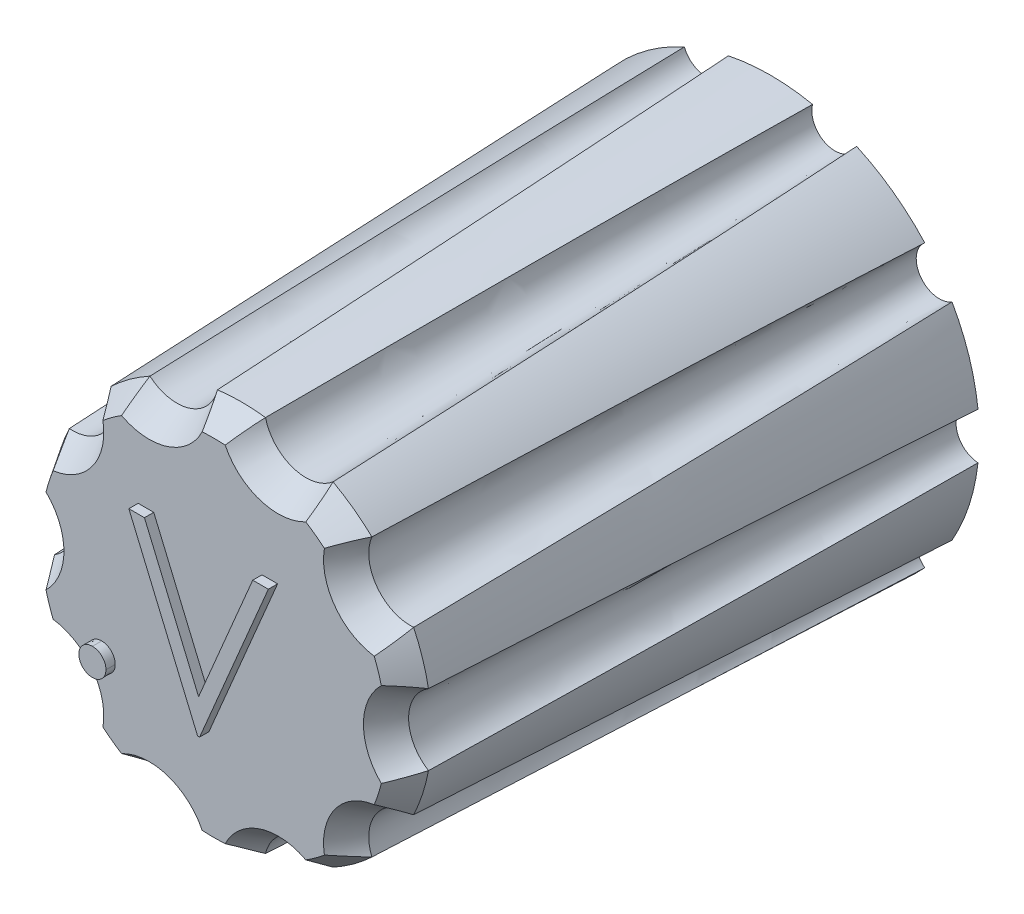
from build123d import *
from OCP.BRepFilletAPI import BRepFilletAPI_MakeChamfer

# Parameters (mm, degrees)
BOSS_EXTRU_1_DEPTH      = 12
BOSS_EXTRU_1_TAPER      = 2
CHANFREIN2_SIZE         = 0.6
CHANFREIN2_SIZE2        = 0.353753521
ENL_V_MAT_EXTRU_1_DEPTH = 10
ESQUISSE4_R             = 0.2
ENL_V_MAT_EXTRU_4_DEPTH = 10
ENL_V_MAT_EXTRU_5_DEPTH = 0.2
BOSS_EXTRU_2_DEPTH      = 0.2
BOSS_EXTRU_2_2_DEPTH    = 0.2
CHANFREIN3_SIZE         = 0.2


with BuildPart() as part:
    # Esquisse1 → Boss.-Extru.1 (new body)
    with BuildSketch(Plane.XY):
        with BuildLine():
            ThreePointArc((4.472222222, -0.499227799), (4, 0), (4.472222222, 0.499227799))
            ThreePointArc((4.472222222, 0.499227799), (4.279754323, 1.390576475), (3.911542518, 2.224822494))
            ThreePointArc((3.911542518, 2.224822494), (3.236067977, 2.351141009), (3.324665043, 3.03259004))
            ThreePointArc((3.324665043, 3.03259004), (2.645033635, 3.640576475), (1.85678652, 4.099066213))
            ThreePointArc((1.85678652, 4.099066213), (1.236067977, 3.804226065), (0.907198818, 4.407605961))
            ThreePointArc((0.907198818, 4.407605961), (0, 4.5), (-0.907198818, 4.407605961))
            ThreePointArc((-0.907198818, 4.407605961), (-1.236067977, 3.804226065), (-1.85678652, 4.099066213))
            ThreePointArc((-1.85678652, 4.099066213), (-2.645033635, 3.640576475), (-3.324665043, 3.03259004))
            ThreePointArc((-3.324665043, 3.03259004), (-3.236067977, 2.351141009), (-3.911542518, 2.224822494))
            ThreePointArc((-3.911542518, 2.224822494), (-4.279754323, 1.390576475), (-4.472222222, 0.499227799))
            ThreePointArc((-4.472222222, 0.499227799), (-4, 0), (-4.472222222, -0.499227799))
            ThreePointArc((-4.472222222, -0.499227799), (-4.279754323, -1.390576475), (-3.911542518, -2.224822494))
            ThreePointArc((-3.911542518, -2.224822494), (-3.236067977, -2.351141009), (-3.324665043, -3.03259004))
            ThreePointArc((-3.324665043, -3.03259004), (-2.645033635, -3.640576475), (-1.85678652, -4.099066213))
            ThreePointArc((-1.85678652, -4.099066213), (-1.236067977, -3.804226065), (-0.907198818, -4.407605961))
            ThreePointArc((-0.907198818, -4.407605961), (0, -4.5), (0.907198818, -4.407605961))
            ThreePointArc((0.907198818, -4.407605961), (1.236067977, -3.804226065), (1.85678652, -4.099066213))
            ThreePointArc((1.85678652, -4.099066213), (2.645033635, -3.640576475), (3.324665043, -3.03259004))
            ThreePointArc((3.324665043, -3.03259004), (3.236067977, -2.351141009), (3.911542518, -2.224822494))
            ThreePointArc((3.911542518, -2.224822494), (4.279754323, -1.390576475), (4.472222222, -0.499227799))
        make_face()
    extrude(amount=BOSS_EXTRU_1_DEPTH, taper=BOSS_EXTRU_1_TAPER)

    # Chanfrein2: one chamfer whose edges measure the first distance from different faces: ONE call of the kernel's chamfer builder (chamfer() names one face for all edges)
    chanfrein2_edges_1 = [part.edges().sort_by_distance(p)[0] for p in [
        (-3.881214819, 1.26108314, 12),
    ]]
    chanfrein2_side_1 = [part.faces().sort_by_distance(p)[0] for p in [
        (-4.080484571, 1.325829807, 6),
    ]]
    chanfrein2_edges_2 = [part.edges().sort_by_distance(p)[0] for p in [
        (-2.897050026, 2.104830049, 12),
    ]]
    chanfrein2_side_2 = [part.faces().sort_by_distance(p)[0] for p in [
        (-3.066559002, 2.227985529, 6),
    ]]
    chanfrein2_edges_3 = [part.edges().sort_by_distance(p)[0] for p in [
        (-2.398722676, 3.301558523, 12),
    ]]
    chanfrein2_side_3 = [part.faces().sort_by_distance(p)[0] for p in [
        (-2.521878155, 3.471067499, 6),
    ]]
    chanfrein2_edges_4 = [part.edges().sort_by_distance(p)[0] for p in [
        (-1.106574643, 3.405686561, 12),
    ]]
    chanfrein2_side_4 = [part.faces().sort_by_distance(p)[0] for p in [
        (-1.17132131, 3.604956313, 6),
    ]]
    chanfrein2_edges_5 = [part.edges().sort_by_distance(p)[0] for p in [
        (0, 4.080950766, 12),
    ]]
    chanfrein2_side_5 = [part.faces().sort_by_distance(p)[0] for p in [
        (0, 4.290475383, 6),
    ]]
    chanfrein2_edges_6 = [part.edges().sort_by_distance(p)[0] for p in [
        (1.106574643, 3.405686561, 12),
    ]]
    chanfrein2_side_6 = [part.faces().sort_by_distance(p)[0] for p in [
        (1.17132131, 3.604956313, 6),
    ]]
    chanfrein2_edges_7 = [part.edges().sort_by_distance(p)[0] for p in [
        (2.398722676, 3.301558523, 12),
    ]]
    chanfrein2_side_7 = [part.faces().sort_by_distance(p)[0] for p in [
        (2.521878155, 3.471067499, 6),
    ]]
    chanfrein2_edges_8 = [part.edges().sort_by_distance(p)[0] for p in [
        (2.897050026, 2.104830049, 12),
    ]]
    chanfrein2_side_8 = [part.faces().sort_by_distance(p)[0] for p in [
        (3.066559002, 2.227985529, 6),
    ]]
    chanfrein2_edges_9 = [part.edges().sort_by_distance(p)[0] for p in [
        (3.881214819, 1.26108314, 12),
    ]]
    chanfrein2_side_9 = [part.faces().sort_by_distance(p)[0] for p in [
        (4.080484571, 1.325829807, 6),
    ]]
    chanfrein2_edges_10 = [part.edges().sort_by_distance(p)[0] for p in [
        (3.580950766, 0, 12),
    ]]
    chanfrein2_side_10 = [part.faces().sort_by_distance(p)[0] for p in [
        (3.790475383, 0, 6),
    ]]
    chanfrein2_edges_11 = [part.edges().sort_by_distance(p)[0] for p in [
        (3.881214819, -1.26108314, 12),
    ]]
    chanfrein2_side_11 = [part.faces().sort_by_distance(p)[0] for p in [
        (4.080484571, -1.325829807, 6),
    ]]
    chanfrein2_edges_12 = [part.edges().sort_by_distance(p)[0] for p in [
        (2.897050026, -2.104830049, 12),
    ]]
    chanfrein2_side_12 = [part.faces().sort_by_distance(p)[0] for p in [
        (3.066559002, -2.227985529, 6),
    ]]
    chanfrein2_edges_13 = [part.edges().sort_by_distance(p)[0] for p in [
        (2.398722676, -3.301558523, 12),
    ]]
    chanfrein2_side_13 = [part.faces().sort_by_distance(p)[0] for p in [
        (2.521878155, -3.471067499, 6),
    ]]
    chanfrein2_edges_14 = [part.edges().sort_by_distance(p)[0] for p in [
        (1.106574643, -3.405686561, 12),
    ]]
    chanfrein2_side_14 = [part.faces().sort_by_distance(p)[0] for p in [
        (1.17132131, -3.604956313, 6),
    ]]
    chanfrein2_edges_15 = [part.edges().sort_by_distance(p)[0] for p in [
        (0, -4.080950766, 12),
    ]]
    chanfrein2_side_15 = [part.faces().sort_by_distance(p)[0] for p in [
        (0, -4.290475383, 6),
    ]]
    chanfrein2_edges_16 = [part.edges().sort_by_distance(p)[0] for p in [
        (-1.106574643, -3.405686561, 12),
    ]]
    chanfrein2_side_16 = [part.faces().sort_by_distance(p)[0] for p in [
        (-1.17132131, -3.604956313, 6),
    ]]
    chanfrein2_edges_17 = [part.edges().sort_by_distance(p)[0] for p in [
        (-2.398722676, -3.301558523, 12),
    ]]
    chanfrein2_side_17 = [part.faces().sort_by_distance(p)[0] for p in [
        (-2.521878155, -3.471067499, 6),
    ]]
    chanfrein2_edges_18 = [part.edges().sort_by_distance(p)[0] for p in [
        (-2.897050026, -2.104830049, 12),
    ]]
    chanfrein2_side_18 = [part.faces().sort_by_distance(p)[0] for p in [
        (-3.066559002, -2.227985529, 6),
    ]]
    chanfrein2_edges_19 = [part.edges().sort_by_distance(p)[0] for p in [
        (-3.881214819, -1.26108314, 12),
    ]]
    chanfrein2_side_19 = [part.faces().sort_by_distance(p)[0] for p in [
        (-4.080484571, -1.325829807, 6),
    ]]
    chanfrein2_edges_20 = [part.edges().sort_by_distance(p)[0] for p in [
        (-3.580950766, 0, 12),
    ]]
    chanfrein2_side_20 = [part.faces().sort_by_distance(p)[0] for p in [
        (-3.790475383, 0, 6),
    ]]
    chanfrein2 = BRepFilletAPI_MakeChamfer(part.part.solid().wrapped)
    for e in chanfrein2_edges_1:
        chanfrein2.Add(CHANFREIN2_SIZE, CHANFREIN2_SIZE2, e.wrapped, chanfrein2_side_1[0].wrapped)  # the first distance lies on this face
    for e in chanfrein2_edges_2:
        chanfrein2.Add(CHANFREIN2_SIZE, CHANFREIN2_SIZE2, e.wrapped, chanfrein2_side_2[0].wrapped)  # the first distance lies on this face
    for e in chanfrein2_edges_3:
        chanfrein2.Add(CHANFREIN2_SIZE, CHANFREIN2_SIZE2, e.wrapped, chanfrein2_side_3[0].wrapped)  # the first distance lies on this face
    for e in chanfrein2_edges_4:
        chanfrein2.Add(CHANFREIN2_SIZE, CHANFREIN2_SIZE2, e.wrapped, chanfrein2_side_4[0].wrapped)  # the first distance lies on this face
    for e in chanfrein2_edges_5:
        chanfrein2.Add(CHANFREIN2_SIZE, CHANFREIN2_SIZE2, e.wrapped, chanfrein2_side_5[0].wrapped)  # the first distance lies on this face
    for e in chanfrein2_edges_6:
        chanfrein2.Add(CHANFREIN2_SIZE, CHANFREIN2_SIZE2, e.wrapped, chanfrein2_side_6[0].wrapped)  # the first distance lies on this face
    for e in chanfrein2_edges_7:
        chanfrein2.Add(CHANFREIN2_SIZE, CHANFREIN2_SIZE2, e.wrapped, chanfrein2_side_7[0].wrapped)  # the first distance lies on this face
    for e in chanfrein2_edges_8:
        chanfrein2.Add(CHANFREIN2_SIZE, CHANFREIN2_SIZE2, e.wrapped, chanfrein2_side_8[0].wrapped)  # the first distance lies on this face
    for e in chanfrein2_edges_9:
        chanfrein2.Add(CHANFREIN2_SIZE, CHANFREIN2_SIZE2, e.wrapped, chanfrein2_side_9[0].wrapped)  # the first distance lies on this face
    for e in chanfrein2_edges_10:
        chanfrein2.Add(CHANFREIN2_SIZE, CHANFREIN2_SIZE2, e.wrapped, chanfrein2_side_10[0].wrapped)  # the first distance lies on this face
    for e in chanfrein2_edges_11:
        chanfrein2.Add(CHANFREIN2_SIZE, CHANFREIN2_SIZE2, e.wrapped, chanfrein2_side_11[0].wrapped)  # the first distance lies on this face
    for e in chanfrein2_edges_12:
        chanfrein2.Add(CHANFREIN2_SIZE, CHANFREIN2_SIZE2, e.wrapped, chanfrein2_side_12[0].wrapped)  # the first distance lies on this face
    for e in chanfrein2_edges_13:
        chanfrein2.Add(CHANFREIN2_SIZE, CHANFREIN2_SIZE2, e.wrapped, chanfrein2_side_13[0].wrapped)  # the first distance lies on this face
    for e in chanfrein2_edges_14:
        chanfrein2.Add(CHANFREIN2_SIZE, CHANFREIN2_SIZE2, e.wrapped, chanfrein2_side_14[0].wrapped)  # the first distance lies on this face
    for e in chanfrein2_edges_15:
        chanfrein2.Add(CHANFREIN2_SIZE, CHANFREIN2_SIZE2, e.wrapped, chanfrein2_side_15[0].wrapped)  # the first distance lies on this face
    for e in chanfrein2_edges_16:
        chanfrein2.Add(CHANFREIN2_SIZE, CHANFREIN2_SIZE2, e.wrapped, chanfrein2_side_16[0].wrapped)  # the first distance lies on this face
    for e in chanfrein2_edges_17:
        chanfrein2.Add(CHANFREIN2_SIZE, CHANFREIN2_SIZE2, e.wrapped, chanfrein2_side_17[0].wrapped)  # the first distance lies on this face
    for e in chanfrein2_edges_18:
        chanfrein2.Add(CHANFREIN2_SIZE, CHANFREIN2_SIZE2, e.wrapped, chanfrein2_side_18[0].wrapped)  # the first distance lies on this face
    for e in chanfrein2_edges_19:
        chanfrein2.Add(CHANFREIN2_SIZE, CHANFREIN2_SIZE2, e.wrapped, chanfrein2_side_19[0].wrapped)  # the first distance lies on this face
    for e in chanfrein2_edges_20:
        chanfrein2.Add(CHANFREIN2_SIZE, CHANFREIN2_SIZE2, e.wrapped, chanfrein2_side_20[0].wrapped)  # the first distance lies on this face
    add(Compound.cast(chanfrein2.Shape()), mode=Mode.REPLACE)

    # Esquisse2 → Enlèv. mat.-Extru.1 (cut)
    with BuildSketch(Plane(origin=(0, 0, 0), x_dir=(-1, 0, 0), z_dir=(0, 0, -1))):
        with BuildLine():
            Line((-2.655183609, -1.6), (2.655183609, -1.6))
            ThreePointArc((2.655183609, -1.6), (2.986726401, -0.830340536), (3.1, 0))
            ThreePointArc((3.1, 0), (-0.830340536, 2.986726401), (-2.655183609, -1.6))
        make_face()
    extrude(amount=-ENL_V_MAT_EXTRU_1_DEPTH, mode=Mode.SUBTRACT)

    # Esquisse4 → Enlèv. mat.-Extru.4 (cut)
    with BuildSketch(Plane(origin=(0, 0, 0), x_dir=(-1, 0, 0), z_dir=(0, 0, -1))):
        with Locations((-2.655183609, -1.6)):
            Circle(ESQUISSE4_R)
        with Locations((2.598076211, -1.6)):
            Circle(ESQUISSE4_R)
    extrude(amount=-ENL_V_MAT_EXTRU_4_DEPTH, mode=Mode.SUBTRACT)

    # Esquisse5 → Enlèv. mat.-Extru.5 (cut)
    with BuildSketch(Plane.XY.offset(12)):
        with BuildLine():
            add(Edge.make_bspline(
                [(-2.413360869, -1.266888341), (-2.393870657, -1.268046507), (-2.355662375, -1.270316958), (-2.300423246, -1.285893631), (-2.250428587, -1.313552292), (-2.205896342, -1.35041507), (-2.169189865, -1.395110733), (-2.140545513, -1.444706642), (-2.125104528, -1.500408235), (-2.122850616, -1.53883791), (-2.121694203, -1.558555007)],
                knots=[0, 0, 0, 0, 1.020151414, 1.999887582, 2.974338812, 3.990962822, 5.007586832, 5.987933904, 6.967670073, 8, 8, 8, 8], degree=3))
            add(Edge.make_bspline(
                [(-2.121694203, -1.558555007), (-2.122889803, -1.577798337), (-2.125247511, -1.615745901), (-2.140510119, -1.671027363), (-2.169408169, -1.720654268), (-2.205643162, -1.765956406), (-2.250439595, -1.802897276), (-2.300541442, -1.830320621), (-2.3555327, -1.847012601), (-2.393849023, -1.849138898), (-2.413360869, -1.850221674)],
                knots=[0, 0, 0, 0, 1.009421747, 1.99056486, 2.972319754, 3.999869655, 5.017953583, 5.993804169, 6.978383603, 8, 8, 8, 8], degree=3))
            add(Edge.make_bspline(
                [(-2.413360869, -1.850221674), (-2.432886775, -1.849178077), (-2.471006458, -1.847140702), (-2.525792452, -1.829977895), (-2.57619942, -1.803154435), (-2.620987132, -1.765887526), (-2.657525604, -1.720887382), (-2.685150987, -1.670685586), (-2.701741136, -1.615904148), (-2.703923008, -1.577829506), (-2.705027536, -1.558555007)],
                knots=[0, 0, 0, 0, 1.022052826, 1.995314843, 2.982371812, 4.00089066, 5.028879526, 6.005146991, 6.990147033, 8, 8, 8, 8], degree=3))
            add(Edge.make_bspline(
                [(-2.705027536, -1.558555007), (-2.703965437, -1.538805628), (-2.701891818, -1.500247388), (-2.685116158, -1.44504828), (-2.657739946, -1.394879841), (-2.620734551, -1.350483261), (-2.576210255, -1.313295958), (-2.52591405, -1.286231165), (-2.47087451, -1.270190753), (-2.432864571, -1.268008236), (-2.413360869, -1.266888341)],
                knots=[0, 0, 0, 0, 1.032775665, 2.016367738, 2.991239715, 4.008302682, 5.025365648, 6.011011707, 6.979408107, 8, 8, 8, 8], degree=3))
        make_face()
        Polygon((-1.628104459, 1.694650121), (-1.291565998, 1.694650121), (-0.124899331, -1.06356302), (1.041767336, 1.694650121), (1.378305797, 1.694650121), (-0.102463433, -1.805349879), (-0.147335228, -1.805349879), align=None)
    extrude(amount=-ENL_V_MAT_EXTRU_5_DEPTH, mode=Mode.SUBTRACT)

    # Chanfrein3
    chanfrein3_edges = [part.edges().sort_by_distance(p)[0] for p in [
        (0.028553699, -1.6, 0),
    ]]
    chamfer(chanfrein3_edges, length=CHANFREIN3_SIZE - 0.0001)  # a hair under: the kernel refuses the full size


with BuildPart() as body_2:
    # Esquisse5<2> → Boss.-Extru.2 (new body)
    with BuildSketch(Plane.XY.offset(12)):
        with BuildLine():
            add(Edge.make_bspline(
                [(-2.413360869, -1.266888341), (-2.393870657, -1.268046507), (-2.355662375, -1.270316958), (-2.300423246, -1.285893631), (-2.250428587, -1.313552292), (-2.205896342, -1.35041507), (-2.169189865, -1.395110733), (-2.140545513, -1.444706642), (-2.125104528, -1.500408235), (-2.122850616, -1.53883791), (-2.121694203, -1.558555007)],
                knots=[0, 0, 0, 0, 1.020151414, 1.999887582, 2.974338812, 3.990962822, 5.007586832, 5.987933904, 6.967670073, 8, 8, 8, 8], degree=3))
            add(Edge.make_bspline(
                [(-2.121694203, -1.558555007), (-2.122889803, -1.577798337), (-2.125247511, -1.615745901), (-2.140510119, -1.671027363), (-2.169408169, -1.720654268), (-2.205643162, -1.765956406), (-2.250439595, -1.802897276), (-2.300541442, -1.830320621), (-2.3555327, -1.847012601), (-2.393849023, -1.849138898), (-2.413360869, -1.850221674)],
                knots=[0, 0, 0, 0, 1.009421747, 1.99056486, 2.972319754, 3.999869655, 5.017953583, 5.993804169, 6.978383603, 8, 8, 8, 8], degree=3))
            add(Edge.make_bspline(
                [(-2.413360869, -1.850221674), (-2.432886775, -1.849178077), (-2.471006458, -1.847140702), (-2.525792452, -1.829977895), (-2.57619942, -1.803154435), (-2.620987132, -1.765887526), (-2.657525604, -1.720887382), (-2.685150987, -1.670685586), (-2.701741136, -1.615904148), (-2.703923008, -1.577829506), (-2.705027536, -1.558555007)],
                knots=[0, 0, 0, 0, 1.022052826, 1.995314843, 2.982371812, 4.00089066, 5.028879526, 6.005146991, 6.990147033, 8, 8, 8, 8], degree=3))
            add(Edge.make_bspline(
                [(-2.705027536, -1.558555007), (-2.703965437, -1.538805628), (-2.701891818, -1.500247388), (-2.685116158, -1.44504828), (-2.657739946, -1.394879841), (-2.620734551, -1.350483261), (-2.576210255, -1.313295958), (-2.52591405, -1.286231165), (-2.47087451, -1.270190753), (-2.432864571, -1.268008236), (-2.413360869, -1.266888341)],
                knots=[0, 0, 0, 0, 1.032775665, 2.016367738, 2.991239715, 4.008302682, 5.025365648, 6.011011707, 6.979408107, 8, 8, 8, 8], degree=3))
        make_face()
    extrude(amount=BOSS_EXTRU_2_DEPTH)


with BuildPart() as body_3:
    # Esquisse5<2> → Boss.-Extru.2 2 (new body)
    with BuildSketch(Plane.XY.offset(12)):
        Polygon((-1.628104459, 1.694650121), (-1.291565998, 1.694650121), (-0.124899331, -1.06356302), (1.041767336, 1.694650121), (1.378305797, 1.694650121), (-0.102463433, -1.805349879), (-0.147335228, -1.805349879), align=None)
    extrude(amount=BOSS_EXTRU_2_2_DEPTH)


solid = Compound([part.part, body_2.part, body_3.part])
